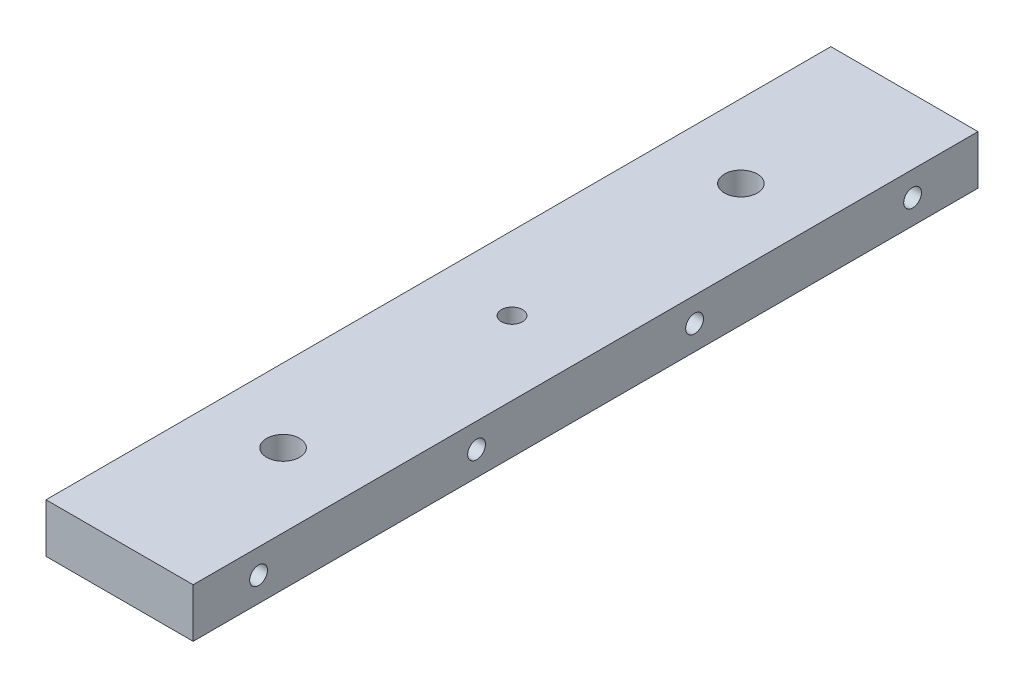
from build123d import *

# Parameters (mm, degrees)
SKETCH2_W           = 28.575
SKETCH2_H           = 152.4
BOSS_EXTRUDE1_DEPTH = 9.525
LPATTERN1_COUNT     = 4
LPATTERN1_PITCH     = 42.333333333
LPATTERN2_COUNT     = 4
LPATTERN2_PITCH     = 42.333333333
SKETCH12_R          = 2.05
SKETCH12_R_2        = 3.2004
CUT_EXTRUDE1_DEPTH  = 156.348048749


with BuildPart() as part:
    # Sketch2 → Boss-Extrude1 (new body)
    with BuildSketch(Plane(origin=(0, 0, 0), x_dir=(1, 0, 0), z_dir=(0, 1, 0))):
        with Locations((14.2875, 76.2)):
            Rectangle(SKETCH2_W, SKETCH2_H)
    extrude(amount=BOSS_EXTRUDE1_DEPTH)

    # Sketch9 → #5 Clearance Hole3 (revolve, cut)
    with BuildSketch(Plane(origin=(0, 4.7625, -139.7), x_dir=(0, 0, 1), z_dir=(0, 1, 0))):
        Polygon((0, 0), (0, 13.737806461), (1.7272, 12.7), (1.7272, 0), align=None)
    f_5_clearance_hole3 = revolve(axis=Axis((-6.35, 4.7625, -139.7), (1, 0, 0)), mode=Mode.SUBTRACT)

    # LPattern1: #5 Clearance Hole3 ×4
    with Locations(*[(0, 0, i * LPATTERN1_PITCH) for i in range(1, LPATTERN1_COUNT)]):
        add(f_5_clearance_hole3, mode=Mode.SUBTRACT)

    # Sketch11 → #5 Clearance Hole4 (revolve, cut)
    with BuildSketch(Plane(origin=(28.575, 4.7625, -12.7), x_dir=(0, 0, -1), z_dir=(0, 1, 0))):
        Polygon((0, 0), (0, 13.737806461), (1.7272, 12.7), (1.7272, 0), align=None)
    f_5_clearance_hole4 = revolve(axis=Axis((34.925, 4.7625, -12.7), (-1, 0, 0)), mode=Mode.SUBTRACT)

    # LPattern2: #5 Clearance Hole4 ×4
    with Locations(*[(0, 0, -i * LPATTERN2_PITCH) for i in range(1, LPATTERN2_COUNT)]):
        add(f_5_clearance_hole4, mode=Mode.SUBTRACT)

    # Sketch12 → Cut-Extrude1 (cut, through all)
    with BuildSketch(Plane(origin=(0, 9.525, 0), x_dir=(1, 0, 0), z_dir=(0, 1, 0))):
        with Locations((14.2875, 76.2)):
            Circle(SKETCH12_R)
        with Locations((14.2875, 31.75)):
            Circle(SKETCH12_R_2)
        with Locations((14.2875, 120.65)):
            Circle(SKETCH12_R_2)
    extrude(amount=-CUT_EXTRUDE1_DEPTH, mode=Mode.SUBTRACT)


solid = part.part
